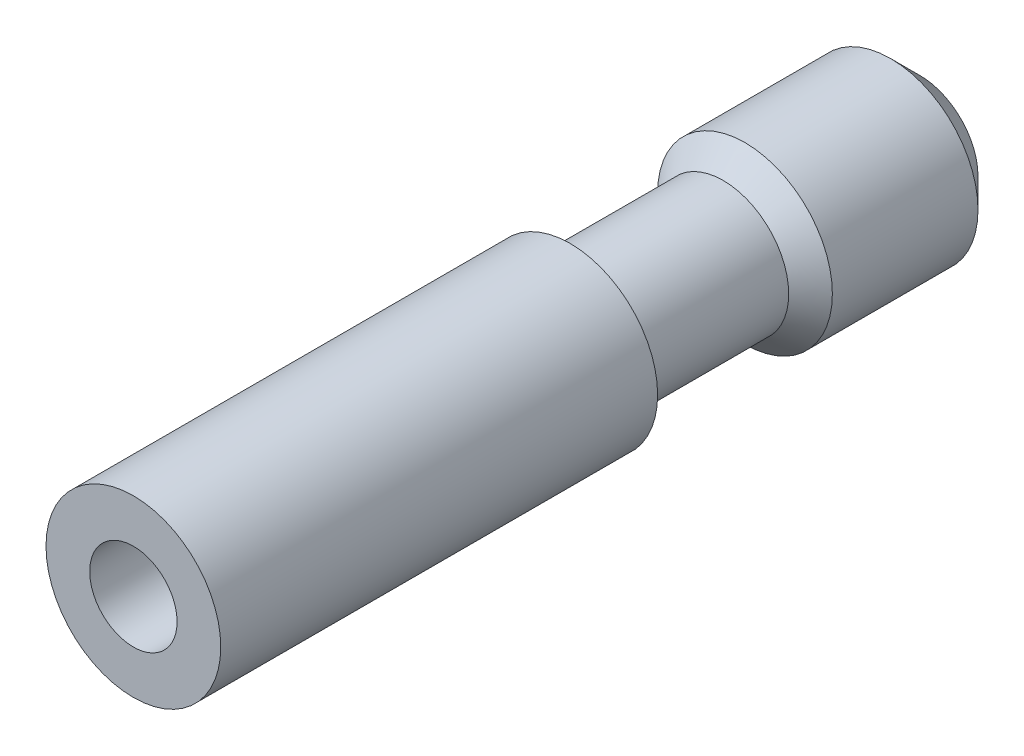
from build123d import *

# Parameters (mm, degrees)
ESQUISSE1_R                         = 3
BOSS_EXTRU_1_DEPTH                  = 27
DIAM_TRE_DU_PER_AGE_3_0_3_1_D       = 3
DIAM_TRE_DU_PER_AGE_3_0_3_1_DEPTH   = 24.5
DIAM_TRE_DU_PER_AGE_3_0_3_1_TIP     = 0.901290929
DIAM_TRE_DU_PER_AGE_2_5_2_5_1_D     = 2.5
DIAM_TRE_DU_PER_AGE_2_5_2_5_1_DEPTH = 3
DIAM_TRE_DU_PER_AGE_2_5_2_5_1_TIP   = 0.751075774
ENL_V_START                         = -15
ESQUISSE6_W                         = 11.750178357
ESQUISSE6_H                         = 11.384595502
ESQUISSE6_R                         = 2.25
ENL_V_MAT_EXTRU_1_DEPTH             = 6
CHANFREIN1_SIZE                     = 1
CHANFREIN2_SIZE                     = 0.75


with BuildPart() as part:
    # Esquisse1 → Boss.-Extru.1 (new body)
    with BuildSketch(Plane.XY):
        Circle(ESQUISSE1_R)
    extrude(amount=BOSS_EXTRU_1_DEPTH)

    # Diamètre du perçage Ø3.0 (3)1
    with Locations(Plane.XY.offset(27)):
        with Locations((0, 0)):
            Hole(DIAM_TRE_DU_PER_AGE_3_0_3_1_D / 2, depth=DIAM_TRE_DU_PER_AGE_3_0_3_1_DEPTH)
            with Locations((0, 0, -(DIAM_TRE_DU_PER_AGE_3_0_3_1_DEPTH + DIAM_TRE_DU_PER_AGE_3_0_3_1_TIP / 2))):  # 118° drill point
                Cone(0, DIAM_TRE_DU_PER_AGE_3_0_3_1_D / 2, DIAM_TRE_DU_PER_AGE_3_0_3_1_TIP, mode=Mode.SUBTRACT)

    # Diamètre du perçage Ø2.5 (2.5)1
    with Locations(Plane(origin=(0, 0, 0), x_dir=(-1, 0, 0), z_dir=(0, 0, -1))):
        with Locations((0, 0)):
            Hole(DIAM_TRE_DU_PER_AGE_2_5_2_5_1_D / 2, depth=DIAM_TRE_DU_PER_AGE_2_5_2_5_1_DEPTH)
            with Locations((0, 0, -(DIAM_TRE_DU_PER_AGE_2_5_2_5_1_DEPTH + DIAM_TRE_DU_PER_AGE_2_5_2_5_1_TIP / 2))):  # 118° drill point
                Cone(0, DIAM_TRE_DU_PER_AGE_2_5_2_5_1_D / 2, DIAM_TRE_DU_PER_AGE_2_5_2_5_1_TIP, mode=Mode.SUBTRACT)

    # Esquisse6 → Enlèv. mat.-Extru.1 (cut)
    with BuildSketch(Plane.XY.offset(27).offset(ENL_V_START)):
        with Locations((-0.219764127, 0.428836611)):
            Rectangle(ESQUISSE6_W, ESQUISSE6_H)
        Circle(ESQUISSE6_R, mode=Mode.SUBTRACT)
    extrude(amount=-ENL_V_MAT_EXTRU_1_DEPTH, mode=Mode.SUBTRACT)

    # Chanfrein1
    chanfrein1_edges = [part.edges().sort_by_distance(p)[0] for p in [
        (-3, 0, 0),
    ]]
    chamfer(chanfrein1_edges, length=CHANFREIN1_SIZE)

    # Chanfrein2
    chanfrein2_edges = [part.edges().sort_by_distance(p)[0] for p in [
        (-2.25, 0, 6),
    ]]
    chamfer(chanfrein2_edges, length=CHANFREIN2_SIZE - 0.0001)  # a hair under: the kernel refuses the full size


solid = part.part
